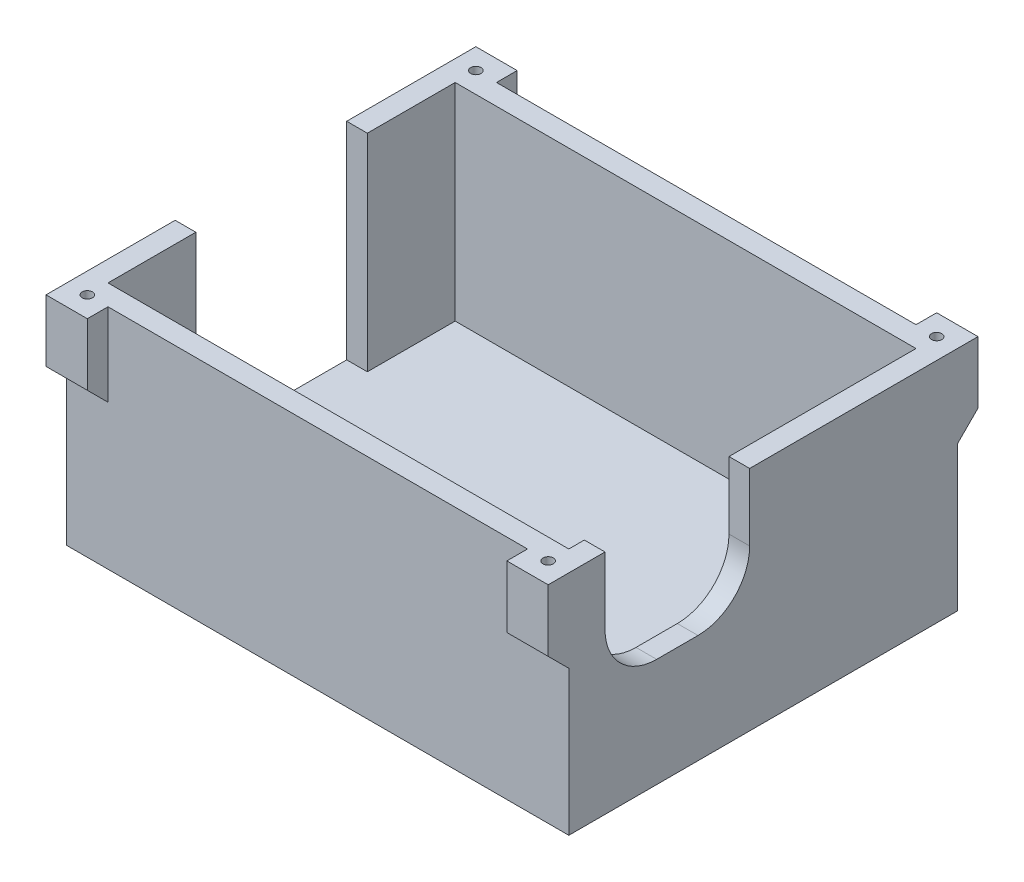
from build123d import *

# Parameters (mm, degrees)
SKETCH1_W           = 48.6
SKETCH1_H           = 37.6
SKETCH1_W_2         = 44.6
SKETCH1_H_2         = 33.6
SKETCH1_W_3         = 44
SKETCH1_H_3         = 33
BOSS_EXTRUDE1_DEPTH = 2
SKETCH1_3_W         = 48.6
SKETCH1_3_H         = 37.6
SKETCH1_3_W_2       = 44.6
SKETCH1_3_H_2       = 33.6
BOSS_EXTRUDE2_DEPTH = 22
SKETCH2_W           = 2
SKETCH2_H           = 16.6
CUT_EXTRUDE1_DEPTH  = 20
SKETCH3_W           = 2
SKETCH3_H           = 14
CUT_EXTRUDE2_DEPTH  = 11.5
FILLET1_R           = 5
SKETCH4_W           = 4
SKETCH4_H           = 2
BOSS_EXTRUDE3_DEPTH = 6
CHAMFER1_SIZE       = 2
SKETCH5_R           = 0.5
CUT_EXTRUDE4_DEPTH  = 6


with BuildPart() as part:
    # Sketch1 → Boss-Extrude1 (new body)
    # profile 1 of 3: a face of its own
    with BuildSketch(Plane(origin=(0, 0, 0), x_dir=(1, 0, 0), z_dir=(0, 1, 0))):
        with Locations((22, 16.5)):
            Rectangle(SKETCH1_W, SKETCH1_H)
        with Locations((22, 16.5)):
            Rectangle(SKETCH1_W_2, SKETCH1_H_2, mode=Mode.SUBTRACT)
    # profile 2 of 3: a face of its own
    with BuildSketch(Plane(origin=(0, 0, 0), x_dir=(1, 0, 0), z_dir=(0, 1, 0))):
        with Locations((22, 16.5)):
            Rectangle(SKETCH1_W_2, SKETCH1_H_2)
        with Locations((22, 16.5)):
            Rectangle(SKETCH1_W_3, SKETCH1_H_3, mode=Mode.SUBTRACT)
    # profile 3 of 3: a face of its own
    with BuildSketch(Plane(origin=(0, 0, 0), x_dir=(1, 0, 0), z_dir=(0, 1, 0))):
        with Locations((22, 16.5)):
            Rectangle(SKETCH1_W_3, SKETCH1_H_3)
    extrude(amount=BOSS_EXTRUDE1_DEPTH)

    # Sketch1<3> → Boss-Extrude2 (add)
    with BuildSketch(Plane(origin=(0, 0, 0), x_dir=(1, 0, 0), z_dir=(0, 1, 0))):
        with Locations((22, 16.5)):
            Rectangle(SKETCH1_3_W, SKETCH1_3_H)
        with Locations((22, 16.5)):
            Rectangle(SKETCH1_3_W_2, SKETCH1_3_H_2, mode=Mode.SUBTRACT)
    extrude(amount=BOSS_EXTRUDE2_DEPTH)

    # Sketch2 → Cut-Extrude1 (cut)
    with BuildSketch(Plane(origin=(0, 22, 0), x_dir=(1, 0, 0), z_dir=(0, 1, 0))):
        with Locations((-1.3, 16.5)):
            Rectangle(SKETCH2_W, SKETCH2_H)
    extrude(amount=-CUT_EXTRUDE1_DEPTH, mode=Mode.SUBTRACT)

    # Sketch3 → Cut-Extrude2 (cut)
    with BuildSketch(Plane(origin=(0, 22, 0), x_dir=(1, 0, 0), z_dir=(0, 1, 0))):
        with Locations((45.3, 8.2)):
            Rectangle(SKETCH3_W, SKETCH3_H)
    extrude(amount=-CUT_EXTRUDE2_DEPTH, mode=Mode.SUBTRACT)

    # Fillet1
    fillet1_edges = [part.edges().sort_by_distance(p)[0] for p in [
        (45.3, 10.5, -15.2),
        (45.3, 10.5, -1.2),
    ]]
    fillet(fillet1_edges, radius=FILLET1_R)

    # Sketch4 → Boss-Extrude3 (add)
    with BuildSketch(Plane(origin=(0, 22, 0), x_dir=(1, 0, 0), z_dir=(0, 1, 0))):
        with Locations((44.3, -3.3)):
            Rectangle(SKETCH4_W, SKETCH4_H)
        with Locations((-0.3, -3.3)):
            Rectangle(SKETCH4_W, SKETCH4_H)
        with Locations((-0.3, 36.3)):
            Rectangle(SKETCH4_W, SKETCH4_H)
        with Locations((44.3, 36.3)):
            Rectangle(SKETCH4_W, SKETCH4_H)
    extrude(amount=-BOSS_EXTRUDE3_DEPTH)

    # Chamfer1
    chamfer1_edges = [part.edges().sort_by_distance(p)[0] for p in [
        (-0.3, 16, 2.3),
        (44.3, 16, 2.3),
        (-0.3, 16, -35.3),
        (44.3, 16, -35.3),
    ]]
    chamfer(chamfer1_edges, length=CHAMFER1_SIZE - 0.0001)  # a hair under: the kernel refuses the full size

    # Sketch5 → Cut-Extrude4 (cut)
    with BuildSketch(Plane(origin=(0, 22, 0), x_dir=(1, 0, 0), z_dir=(0, 1, 0))):
        with Locations(Location((44.3, -2.3, 0), (0, 0, 270))):
            Circle(SKETCH5_R)
        with Locations(Location((-0.3, -2.3, 0), (0, 0, 270))):
            Circle(SKETCH5_R)
        with Locations(Location((-0.3, 35.3, 0), (0, 0, 270))):
            Circle(SKETCH5_R)
        with Locations(Location((44.3, 35.3, 0), (0, 0, 270))):
            Circle(SKETCH5_R)
    extrude(amount=-CUT_EXTRUDE4_DEPTH, mode=Mode.SUBTRACT)


solid = part.part
